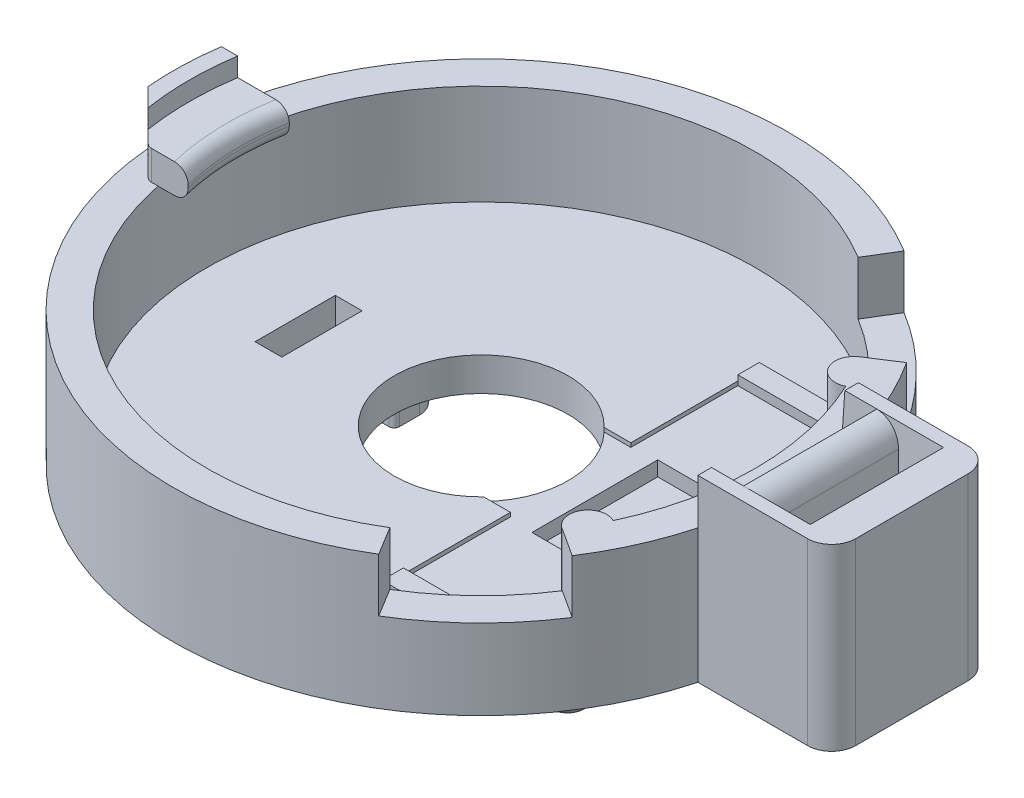
from build123d import *

# Parameters (mm, degrees)
SKETCH3_R                      = 11.5
BOSS_EXTRUDE2_DEPTH            = 5
SKETCH4_R                      = 10.25
CUT_EXTRUDE2_DEPTH             = 3.75
SKETCH5_W                      = 4.998198344
SKETCH5_H                      = 6
BOSS_EXTRUDE3_DEPTH            = 6.7
FILLET1_R                      = 0.9
SKETCH6_R                      = 3.25
CUT_EXTRUDE3_DEPTH             = 21.522244029
CUT_EXTRUDE4_START             = -2
CUT_EXTRUDE4_DEPTH             = 2
SKETCH9_R                      = 0.75
BOSS_EXTRUDE4_DEPTH            = 1.5
FILLET2_R                      = 0.3
BOSS_EXTRUDE5_DEPTH            = 1.5
BOSS_EXTRUDE7_DEPTH            = 2
SKETCH12_W                     = 1
SKETCH12_H                     = 3
CUT_EXTRUDE5_DEPTH             = 21.603943797
BOSS_EXTRUDE8_DEPTH            = 1.5
FILLET3_R                      = 0.8
FILLET4_R                      = 0.2
CUT_EXTRUDE6_DEPTH             = 21.987138919
CUT_EXTRUDE6_TAPER             = -4.2
FILLET5_R                      = 0.9
CUT_EXTRUDE7_REACH             = 22.987
CUT_EXTRUDE7_DIRECTION_2_REACH = 22.987
SKETCH17_W                     = 1.4
SKETCH17_H                     = 4.984034488
CUT_EXTRUDE8_DEPTH             = 0.4
CUT_EXTRUDE8_DRAFT             = -4.2
SKETCH18_W                     = 2
SKETCH18_H                     = 4.7
CUT_EXTRUDE9_DEPTH             = 0.7
CUT_EXTRUDE10_DEPTH            = 0.15
SKETCH20_W                     = 4.778830525
SKETCH20_H                     = 0.8
BOSS_EXTRUDE9_DEPTH            = 0.2
BOSS_EXTRUDE10_DEPTH           = 3.9
SKETCH23_W                     = 3.917226761
SKETCH23_H                     = 1.05
BOSS_EXTRUDE13_DEPTH           = 0.15
FILLET6_START                  = -2.35
FILLET6_DEPTH                  = 4.7
BOSS_EXTRUDE14_START           = 0.2
BOSS_EXTRUDE14_DEPTH           = 1.1
FILLET7_R                      = 0.5
FILLET8_R                      = 0.3


with BuildPart() as part:
    # Sketch3 → Boss-Extrude2 (new body)
    with BuildSketch(Plane(origin=(0, 0, 0), x_dir=(1, 0, 0), z_dir=(0, 1, 0))):
        with Locations(Location((0, 0, 0), (0, 0, 270))):
            Circle(SKETCH3_R)
    extrude(amount=BOSS_EXTRUDE2_DEPTH)

    # Sketch4 → Cut-Extrude2 (cut)
    with BuildSketch(Plane(origin=(0, 5, 0), x_dir=(1, 0, 0), z_dir=(0, 1, 0))):
        with Locations(Location((0, 0, 0), (0, 0, 270))):
            Circle(SKETCH4_R)
    extrude(amount=-CUT_EXTRUDE2_DEPTH, mode=Mode.SUBTRACT)

    # Sketch5 → Boss-Extrude3 (add)
    with BuildSketch(Plane.XZ):
        with Locations((13.600900828, 0)):
            Rectangle(SKETCH5_W, SKETCH5_H)
    extrude(amount=-BOSS_EXTRUDE3_DEPTH)

    # Fillet1
    fillet1_edges = [part.edges().sort_by_distance(p)[0] for p in [
        (16.1, 3.35, 3),
        (16.1, 3.35, -3),
    ]]
    fillet(fillet1_edges, radius=FILLET1_R)

    # Sketch6 → Cut-Extrude3 (cut, through all)
    with BuildSketch(Plane(origin=(0, 1.25, 0), x_dir=(1, 0, 0), z_dir=(0, 1, 0))):
        with Locations(Location((0, 0, 0), (0, 0, 270))):
            Circle(SKETCH6_R)
    extrude(amount=-CUT_EXTRUDE3_DEPTH, mode=Mode.SUBTRACT)

    # Sketch8 → Cut-Extrude4 (cut)
    with BuildSketch(Plane(origin=(0, 5, 0), x_dir=(1, 0, 0), z_dir=(0, 1, 0)).offset(CUT_EXTRUDE4_START)):
        with BuildLine():
            Line((5.989580483, 9.817073171), (5.338539126, 8.75))
            ThreePointArc((5.338539126, 8.75), (7.125536767, 7.318730606), (8.604088235, 5.570652174))
            Line((8.604088235, 5.570652174), (9.653367288, 6.25))
            ThreePointArc((9.653367288, 6.25), (8.022247596, 8.23975385), (5.989580483, 9.817073171))
        make_face()
        with BuildLine():
            Line((9.653367288, -6.25), (8.604088235, -5.570652174))
            ThreePointArc((8.604088235, -5.570652174), (7.150264162, -7.344128431), (5.338539126, -8.75))
            Line((5.338539126, -8.75), (5.989580483, -9.817073171))
            ThreePointArc((5.989580483, -9.817073171), (8.022247596, -8.23975385), (9.653367288, -6.25))
        make_face()
    extrude(amount=CUT_EXTRUDE4_DEPTH, mode=Mode.SUBTRACT)

    # Sketch9 → Boss-Extrude4 (add)
    with BuildSketch(Plane.XZ):
        with Locations(Location((7.76740441, 4.54614438, 0), (0, 0, 90))):
            Circle(SKETCH9_R)
        with Locations(Location((0.053374318, -8.999841731, 0), (0, 0, 90))):
            Circle(SKETCH9_R)
        with Locations(Location((-7.820778728, 4.453697351, 0), (0, 0, 90))):
            Circle(SKETCH9_R)
    extrude(amount=BOSS_EXTRUDE4_DEPTH)

    # Fillet2
    fillet2_edges = [part.edges().sort_by_distance(p)[0] for p in [
        (7.76740441, -1.5, 3.79614438),
        (0.053374318, -1.5, -9.749841731),
        (-7.820778728, -1.5, 3.703697351),
    ]]
    fillet(fillet2_edges, radius=FILLET2_R)

    # Sketch10 → Boss-Extrude5 (add)
    with BuildSketch(Plane.XZ):
        with BuildLine():
            Line((-11.486037743, -0.566512984), (-10.234332564, -0.566512984))
            ThreePointArc((-10.234332564, -0.566512984), (-9.959628222, 2.422458603), (-8.830856917, 5.203697351))
            Line((-8.830856917, 5.203697351), (-10.255317347, 5.203697351))
            ThreePointArc((-10.255317347, 5.203697351), (-11.247020144, 2.39886179), (-11.486037743, -0.566512984))
        make_face()
    extrude(amount=BOSS_EXTRUDE5_DEPTH)

    # Sketch11 → Boss-Extrude7 (add)
    with BuildSketch(Plane(origin=(0, 5, 0), x_dir=(1, 0, 0), z_dir=(0, 1, 0))):
        with BuildLine():
            Line((-11.37769989, 1.672705953), (-10.77088923, 1.672705953))
            ThreePointArc((-10.77088923, 1.672705953), (-10.9, 0), (-10.77088923, -1.672705953))
            Line((-10.77088923, -1.672705953), (-11.457658049, -0.985937134))
            ThreePointArc((-11.457658049, -0.985937134), (-11.494802687, 0.34570389), (-11.37769989, 1.672705953))
        make_face()
    extrude(amount=BOSS_EXTRUDE7_DEPTH)

    # Sketch12 → Cut-Extrude5 (cut, through all)
    with BuildSketch(Plane(origin=(0, 1.25, 0), x_dir=(1, 0, 0), z_dir=(0, 1, 0))):
        with Locations((-6.45, 0)):
            Rectangle(SKETCH12_W, SKETCH12_H)
    extrude(amount=-CUT_EXTRUDE5_DEPTH, mode=Mode.SUBTRACT)

    # Sketch13 → Boss-Extrude8 (add)
    with BuildSketch(Plane.XZ):
        Polygon((-6.95, 1), (-6.95, 1.5), (-5.95, 1.5), (-5.95, -1.5), (-6.95, -1.5), (-6.95, -1), (-7.75, -1), (-7.75, -2.75), (-4.25, -2.75), (-4.25, -1), (-5.15, -1), (-5.15, 1), (-4.25, 1), (-4.25, 2.75), (-7.75, 2.75), (-7.75, 1), align=None)
    extrude(amount=BOSS_EXTRUDE8_DEPTH)

    # Fillet3
    fillet3_edges = [part.edges().sort_by_distance(p)[0] for p in [
        (-7.75, -0.75, -2.75),
        (-4.25, -0.75, -2.75),
        (-4.25, -0.75, 2.75),
        (-7.75, -0.75, 2.75),
    ]]
    fillet(fillet3_edges, radius=FILLET3_R)

    # Fillet4
    fillet4_edges = [part.edges().sort_by_distance(p)[0] for p in [
        (-4.25, -0.75, -1),
        (-5.15, -0.75, -1),
        (-5.15, -0.75, 1),
        (-4.25, -0.75, 1),
    ]]
    fillet(fillet4_edges, radius=FILLET4_R)

    # Sketch14 → Cut-Extrude6 (cut, through all)
    with BuildSketch(Plane.XZ):
        Polygon((14.3, 0.6), (14.1, 0.6), (14.1, 2), (13.6, 2), (13.6, -2), (14.1, -2), (14.1, -0.6), (14.3, -0.6), align=None)
    extrude(amount=-CUT_EXTRUDE6_DEPTH, taper=CUT_EXTRUDE6_TAPER, mode=Mode.SUBTRACT)

    # Fillet5
    fillet5_edges = [part.edges().sort_by_distance(p)[0] for p in [
        (13.107982756, 6.7, 0),
    ]]
    fillet(fillet5_edges, radius=FILLET5_R)

    # Cut-Extrude7: up to this plane
    cut_extrude7_end = Plane(origin=(14.1, 0, -2), z_dir=(0, -0.07323819712763185, -0.9973144772244581))
    # Sketch16 → Cut-Extrude7 (cut, up to the surface)
    with BuildSketch(Plane.XY, mode=Mode.PRIVATE) as cut_extrude7_sk1:
        Polygon((12.3, 6.7), (11.101801656, 5.501801656), (10.901801656, 5.501801656), (10.901801656, 6.7), align=None)
    cut_extrude7_tool1 = split(extrude(cut_extrude7_sk1.sketch, amount=-CUT_EXTRUDE7_REACH, mode=Mode.PRIVATE), bisect_by=cut_extrude7_end, keep=Keep.BOTH, mode=Mode.PRIVATE)
    add(cut_extrude7_tool1.solids().sort_by_distance((11.37621, 6.250619, 0))[0], mode=Mode.SUBTRACT)

    # Cut-Extrude7 direction 2: up to this plane
    cut_extrude7_direction_2_end = Plane(origin=(13.6, 0, 2), z_dir=(0, -0.07323819712763185, 0.9973144772244581))
    # Sketch16 → Cut-Extrude7 direction 2 (cut, up to the surface)
    with BuildSketch(Plane.XY, mode=Mode.PRIVATE) as cut_extrude7_direction_2_sk1:
        Polygon((12.3, 6.7), (11.101801656, 5.501801656), (10.901801656, 5.501801656), (10.901801656, 6.7), align=None)
    cut_extrude7_direction_2_tool1 = split(extrude(cut_extrude7_direction_2_sk1.sketch, amount=CUT_EXTRUDE7_DIRECTION_2_REACH, mode=Mode.PRIVATE), bisect_by=cut_extrude7_direction_2_end, keep=Keep.BOTH, mode=Mode.PRIVATE)
    add(cut_extrude7_direction_2_tool1.solids().sort_by_distance((11.37621, 6.250619, 0))[0], mode=Mode.SUBTRACT)


with BuildPart() as cut_extrude8_tool:
    # Sketch17 → Cut-Extrude8 (with draft: the straight prism first)
    with BuildSketch(Plane(origin=(0, 6.7, 0), x_dir=(1, 0, 0), z_dir=(0, 1, 0))):
        with Locations((14.092017244, 0)):
            Rectangle(SKETCH17_W, SKETCH17_H)
    extrude(amount=-CUT_EXTRUDE8_DEPTH)
    # Cut-Extrude8: the draft: its side faces are tilted about the plane it starts from
    cut_extrude8_sides = [cut_extrude8_tool.faces().sort_by_distance(p)[0] for p in [
        (13.392017244, 6.5, 0),
        (14.092017244, 6.5, 2.492017244),
        (14.792017244, 6.5, 0),
        (14.092017244, 6.5, -2.492017244),
    ]]
    draft(cut_extrude8_sides, Plane(origin=(0, 6.7, 0), x_dir=(1, 0, 0), z_dir=(0, 1, 0)), CUT_EXTRUDE8_DRAFT)


with BuildPart() as part_1:
    add(part.part)

    # Cut-Extrude8: cut by cut_extrude8_tool
    add(cut_extrude8_tool.part, mode=Mode.SUBTRACT)

    # Sketch18 → Cut-Extrude9 (cut)
    with BuildSketch(Plane(origin=(0, 1.25, 0), x_dir=(1, 0, 0), z_dir=(0, 1, 0))):
        with Locations((5.25, 0)):
            Rectangle(SKETCH18_W, SKETCH18_H)
    extrude(amount=-CUT_EXTRUDE9_DEPTH, mode=Mode.SUBTRACT)

    # Sketch19 → Cut-Extrude10 (cut)
    with BuildSketch(Plane(origin=(0, 1.25, 0), x_dir=(1, 0, 0), z_dir=(0, 1, 0))):
        with BuildLine():
            Line((2.34520788, 2.25), (3.34520788, 2.25))
            Line((3.34520788, 2.25), (3.34520788, 6.25))
            Line((3.34520788, 6.25), (8.124038405, 6.25))
            ThreePointArc((8.124038405, 6.25), (10.25, 0), (8.124038405, -6.25))
            Line((8.124038405, -6.25), (3.34520788, -6.25))
            Line((3.34520788, -6.25), (3.34520788, -2.25))
            Line((3.34520788, -2.25), (2.34520788, -2.25))
            ThreePointArc((2.34520788, -2.25), (3.25, 0), (2.34520788, 2.25))
        make_face()
    extrude(amount=-CUT_EXTRUDE10_DEPTH, mode=Mode.SUBTRACT)

    # Sketch20 → Boss-Extrude9 (add)
    with BuildSketch(Plane(origin=(0, 1.25, 0), x_dir=(1, 0, 0), z_dir=(0, 1, 0))):
        with Locations((5.734623143, 6.65)):
            Rectangle(SKETCH20_W, SKETCH20_H)
        with Locations((5.734623143, -6.65)):
            Rectangle(SKETCH20_W, SKETCH20_H)
    extrude(amount=BOSS_EXTRUDE9_DEPTH)

    # Sketch21 → Boss-Extrude10 (add)
    with BuildSketch(Plane(origin=(0, 1.1, 0), x_dir=(1, 0, 0), z_dir=(0, 1, 0))):
        with BuildLine():
            ThreePointArc((8.604088235, 5.570652174), (8.352045113, 4.630965604), (9.282577349, 4.346982604))
            ThreePointArc((9.282577349, 4.346982604), (8.964236902, 4.970408109), (8.604088235, 5.570652174))
        make_face()
        with BuildLine():
            ThreePointArc((9.282577349, -4.346982604), (8.352045113, -4.630965604), (8.604088235, -5.570652174))
            ThreePointArc((8.604088235, -5.570652174), (8.964236902, -4.970408109), (9.282577349, -4.346982604))
        make_face()
    extrude(amount=BOSS_EXTRUDE10_DEPTH)

    # Sketch23 → Boss-Extrude13 (add)
    with BuildSketch(Plane(origin=(0, 1.1, 0), x_dir=(1, 0, 0), z_dir=(0, 1, 0))):
        with Locations((8.208613381, 1.825)):
            Rectangle(SKETCH23_W, SKETCH23_H)
        with Locations((8.208613381, -1.825)):
            Rectangle(SKETCH23_W, SKETCH23_H)
    extrude(amount=BOSS_EXTRUDE13_DEPTH)

    # Fillet6: read off the stored shape, not the designer's step
    # Fillet6 outline → Fillet6 (cut)
    with BuildSketch(Plane.XY.offset(FILLET6_START)):
        with BuildLine():
            ThreePointArc((6.25, 1.05), (6.308578644, 1.191421356), (6.45, 1.25))
            Line((6.45, 1.25), (6.25, 1.25))
            Line((6.25, 1.25), (6.25, 1.05))
        make_face()
    extrude(amount=FILLET6_DEPTH, mode=Mode.SUBTRACT)

    # Sketch24 → Boss-Extrude14 (add)
    with BuildSketch(Plane(origin=(0, 5, 0), x_dir=(1, 0, 0), z_dir=(0, 1, 0)).offset(BOSS_EXTRUDE14_START)):
        with BuildLine():
            Line((-10.77088923, 1.672705953), (-8.844184369, 1.672705953))
            ThreePointArc((-8.844184369, 1.672705953), (-8.996491528, -0.284046722), (-8.721049454, -2.227294047))
            Line((-8.721049454, -2.227294047), (-10.216301136, -2.227294047))
            Line((-10.216301136, -2.227294047), (-10.77088923, -1.672705953))
            ThreePointArc((-10.77088923, -1.672705953), (-10.9, 0), (-10.77088923, 1.672705953))
        make_face()
    extrude(amount=BOSS_EXTRUDE14_DEPTH)

    # Fillet7
    fillet7_edges = [part_1.edges().sort_by_distance(p)[0] for p in [
        (-8.996491528, 5.2, 0.284046722),
        (-8.996491528, 6.3, 0.284046722),
    ]]
    fillet(fillet7_edges, radius=FILLET7_R)

    # Fillet8
    fillet8_edges = [part_1.edges().sort_by_distance(p)[0] for p in [
        (-10.216301136, 5.75, 2.227294047),
    ]]
    fillet(fillet8_edges, radius=FILLET8_R)


solid = part_1.part
